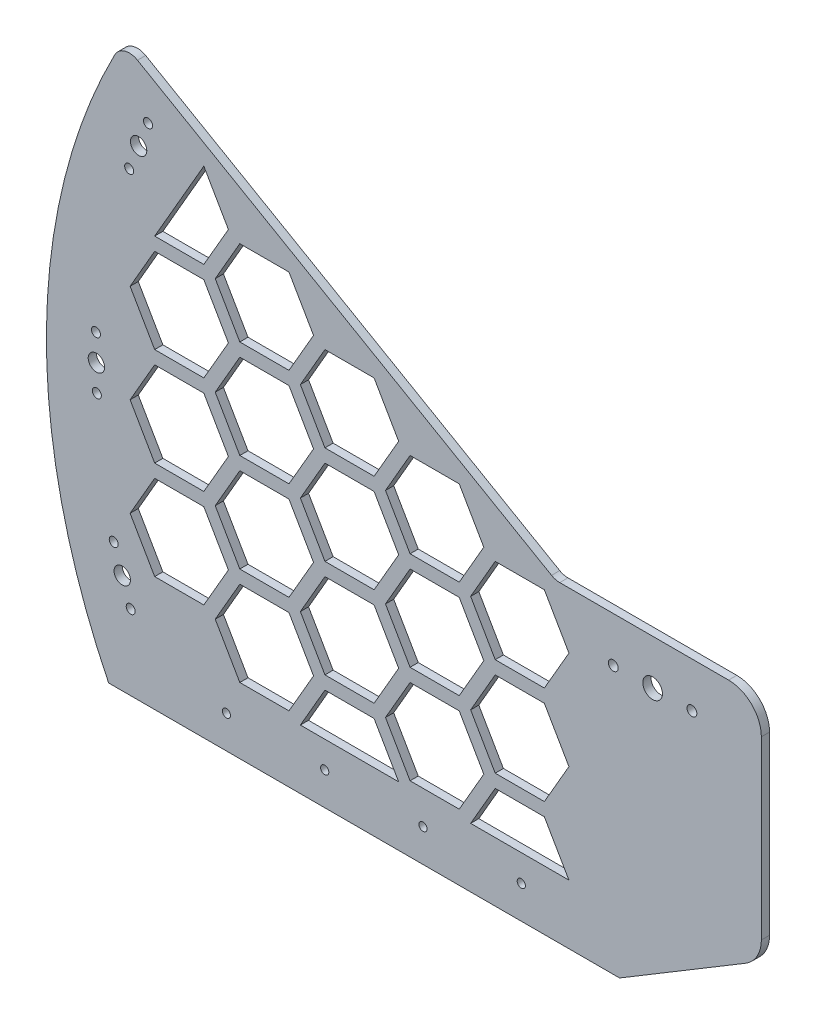
from build123d import *

# Parameters (mm, degrees)
BOSS_EXTRUDE1_OUTLINE_R   = 2.75
BOSS_EXTRUDE1_OUTLINE_R_2 = 5
BOSS_EXTRUDE1_OUTLINE_R_3 = 2.499999993
BOSS_EXTRUDE1_OUTLINE_R_4 = 3
BOSS_EXTRUDE1_OUTLINE_R_5 = 6
BOSS_EXTRUDE1_DEPTH       = 5
CUT_EXTRUDE1_DEPTH        = 5


# Read off the part's stored shape, not the designer's step: Boss-Extrude1
with BuildPart() as part:
    # Boss-Extrude1 outline → Boss-Extrude1 (new body)
    with BuildSketch(Plane.XY):
        with BuildLine():
            ThreePointArc((56.677553307, -117.080446425), (63.779903671, -109.786095566), (66.371177049, -99.940475351))
            Line((66.371177049, -99.940475351), (66.371177049, 7.470187014))
            ThreePointArc((66.371177049, 7.470187014), (60.513312673, 21.612322638), (46.371177049, 27.470187014))
            Line((46.371177049, 27.470187014), (-56.688822951, 27.470187014))
            ThreePointArc((-56.688822951, 27.470187014), (-59.277013402, 27.810928751), (-61.688822951, 28.809932976))
            Line((-61.688822951, 28.809932976), (-314.412271613, 174.719884092))
            ThreePointArc((-314.412271613, 174.719884092), (-322.213114889, 175.659384058), (-328.284834714, 170.672397556))
            ThreePointArc((-328.284834714, 170.672397556), (-369.976805992, 4.142827069), (-332.024261256, -163.278565422))
            Line((-332.024261256, -163.278565422), (-20.152013506, -163.278565422))
            Line((-20.152013506, -163.278565422), (56.677553307, -117.080446425))
        make_face()
        with Locations((-318.548901543, -117.417406357)):
            Circle(BOSS_EXTRUDE1_OUTLINE_R, mode=Mode.SUBTRACT)
        with Locations((-323.727269541, -102.278565422)):
            Circle(BOSS_EXTRUDE1_OUTLINE_R_2, mode=Mode.SUBTRACT)
        with Locations((-328.90563754, -87.139724486)):
            Circle(BOSS_EXTRUDE1_OUTLINE_R, mode=Mode.SUBTRACT)
        with Locations((-260.152013506, -143.278565422)):
            Circle(BOSS_EXTRUDE1_OUTLINE_R_3, mode=Mode.SUBTRACT)
        with Locations((-200.152013506, -143.278565422)):
            Circle(BOSS_EXTRUDE1_OUTLINE_R_3, mode=Mode.SUBTRACT)
        with Locations((-339.2241853, -13.682181731)):
            Circle(BOSS_EXTRUDE1_OUTLINE_R, mode=Mode.SUBTRACT)
        with Locations((-339.492103151, 2.315574988)):
            Circle(BOSS_EXTRUDE1_OUTLINE_R_2, mode=Mode.SUBTRACT)
        with Locations((-140.152013506, -143.278565422)):
            Circle(BOSS_EXTRUDE1_OUTLINE_R_3, mode=Mode.SUBTRACT)
        with Locations((-80.152013506, -143.278565422)):
            Circle(BOSS_EXTRUDE1_OUTLINE_R_3, mode=Mode.SUBTRACT)
        with Locations((-24, 0)):
            Circle(BOSS_EXTRUDE1_OUTLINE_R_4, mode=Mode.SUBTRACT)
        with Locations((1.6e-08, 2e-09)):
            Circle(BOSS_EXTRUDE1_OUTLINE_R_5, mode=Mode.SUBTRACT)
        with Locations((24, 0)):
            Circle(BOSS_EXTRUDE1_OUTLINE_R_4, mode=Mode.SUBTRACT)
        with Locations((-339.760021002, 18.313331706)):
            Circle(BOSS_EXTRUDE1_OUTLINE_R, mode=Mode.SUBTRACT)
        with Locations((-319.497069854, 114.812335336)):
            Circle(BOSS_EXTRUDE1_OUTLINE_R, mode=Mode.SUBTRACT)
        with Locations((-313.732870505, 129.737951098)):
            Circle(BOSS_EXTRUDE1_OUTLINE_R_2, mode=Mode.SUBTRACT)
        with Locations((-307.968671157, 144.66356686)):
            Circle(BOSS_EXTRUDE1_OUTLINE_R, mode=Mode.SUBTRACT)
    extrude(amount=BOSS_EXTRUDE1_DEPTH)

    # Sketch2 → Cut-Extrude1 (cut)
    with BuildSketch(Plane.XY.offset(5)):
        Polygon((-155, -7), (-170, 18.980762114), (-200, 18.980762114), (-215, -7), (-200, -32.980762114), (-170, -32.980762114), align=None)
        Polygon((-103.038475773, -37), (-118.038475773, -11.019237886), (-148.038475773, -11.019237886), (-163.038475773, -37), (-148.038475773, -62.980762114), (-118.038475773, -62.980762114), align=None)
        Polygon((-215, -127), (-155, -127), (-170, -101.019237886), (-200, -101.019237886), align=None)
        Polygon((-111.076951546, -127), (-51.076951546, -127), (-66.076951546, -101.019237886), (-96.076951546, -101.019237886), align=None)
        Polygon((-51.076951546, -67), (-66.076951546, -41.019237886), (-96.076951546, -41.019237886), (-111.076951546, -67), (-96.076951546, -92.980762114), (-66.076951546, -92.980762114), align=None)
        Polygon((-118.038475773, -2.980762114), (-103.038475773, 23), (-118.038475773, 48.980762114), (-148.038475773, 48.980762114), (-163.038475773, 23), (-148.038475773, -2.980762114), align=None)
        Polygon((-258.923048454, 53), (-273.923048454, 78.980762114), (-303.923048454, 78.980762114), (-318.923048454, 53), (-303.923048454, 27.019237886), (-273.923048454, 27.019237886), align=None)
        Polygon((-206.961524227, 23), (-221.961524227, 48.980762114), (-251.961524227, 48.980762114), (-266.961524227, 23), (-251.961524227, -2.980762114), (-221.961524227, -2.980762114), align=None)
        Polygon((-221.961524227, 57.019237886), (-206.961524227, 83), (-221.961524227, 108.980762114), (-251.961524227, 108.980762114), (-266.961524227, 83), (-251.961524227, 57.019237886), align=None)
        Polygon((-170, 27.019237886), (-155, 53), (-170, 78.980762114), (-200, 78.980762114), (-215, 53), (-200, 27.019237886), align=None)
        Polygon((-66.076951546, -32.980762114), (-51.076951546, -7), (-66.076951546, 18.980762114), (-96.076951546, 18.980762114), (-111.076951546, -7), (-96.076951546, -32.980762114), align=None)
        Polygon((-103.038475773, -97), (-118.038475773, -71.019237886), (-148.038475773, -71.019237886), (-163.038475773, -97), (-148.038475773, -122.980762114), (-118.038475773, -122.980762114), align=None)
        Polygon((-170, -41.019237886), (-200, -41.019237886), (-215, -67), (-200, -92.980762114), (-170, -92.980762114), (-155, -67), align=None)
        Polygon((-273.923048454, -32.980762114), (-258.923048454, -7), (-273.923048454, 18.980762114), (-303.923048454, 18.980762114), (-318.923048454, -7), (-303.923048454, -32.980762114), align=None)
        Polygon((-221.961524227, -62.980762114), (-206.961524227, -37), (-221.961524227, -11.019237886), (-251.961524227, -11.019237886), (-266.961524227, -37), (-251.961524227, -62.980762114), align=None)
        Polygon((-273.923048454, 87.019237886), (-258.923048454, 113), (-273.923048454, 138.980762114), (-303.923048454, 87.019237886), align=None)
        Polygon((-303.923048454, -92.980762114), (-273.923048454, -92.980762114), (-258.923048454, -67), (-273.923048454, -41.019237886), (-303.923048454, -41.019237886), (-318.923048454, -67), align=None)
        Polygon((-206.961524227, -97), (-221.961524227, -71.019237886), (-251.961524227, -71.019237886), (-266.961524227, -97), (-251.961524227, -122.980762114), (-221.961524227, -122.980762114), align=None)
    extrude(amount=-CUT_EXTRUDE1_DEPTH, mode=Mode.SUBTRACT)


solid = part.part
